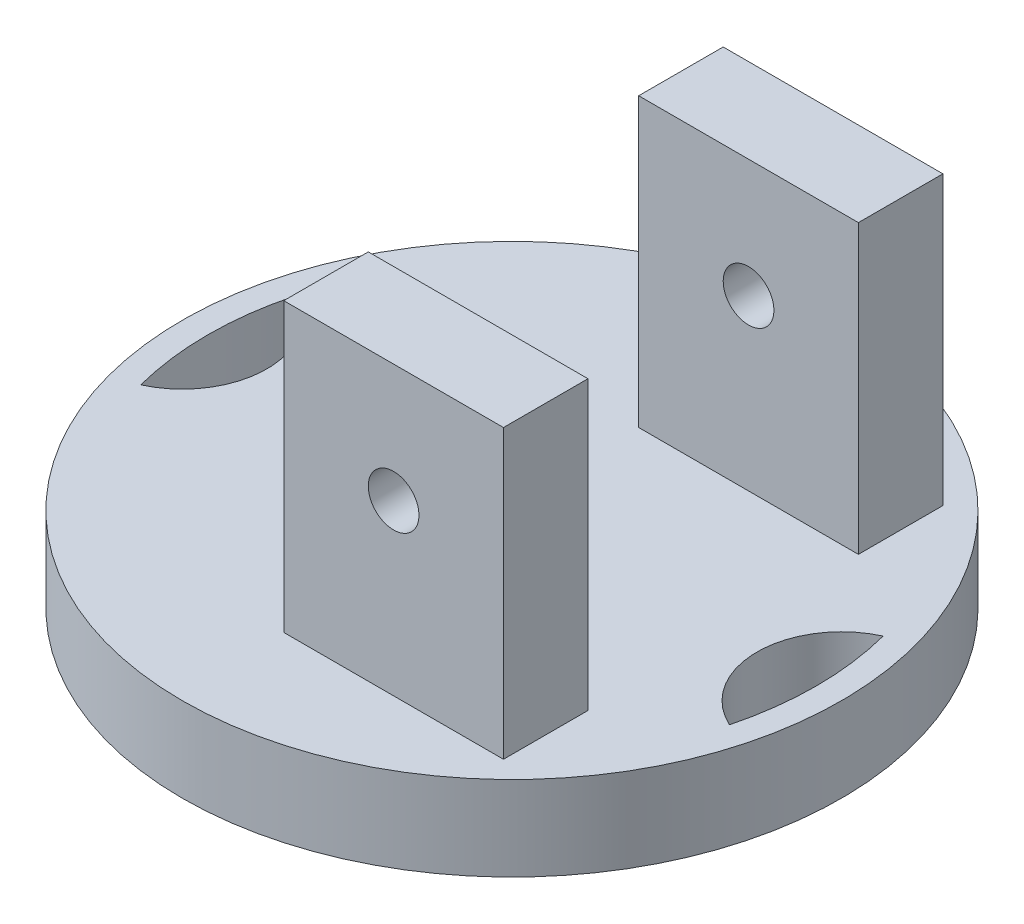
from build123d import *

# Parameters (mm, degrees)
SKETCH1_R           = 24.765
PLATE_DEPTH         = 6.35
SKETCH2_W           = 16.51
SKETCH2_H           = 6.35
HOOK_UPRIGHTS_DEPTH = 21.59
SKETCH3_R           = 1.905
HOOK_BOLTHOLE_DEPTH = 56.655857284


with BuildPart() as part:
    # Sketch1 → plate (new body)
    with BuildSketch(Plane(origin=(0, 0, 0), x_dir=(1, 0, 0), z_dir=(0, 1, 0))):
        Circle(SKETCH1_R)
        with BuildLine():
            ThreePointArc((-22.119166667, -5.772526827), (-22.86, 0), (-22.119166667, 5.772526827))
            ThreePointArc((-22.119166667, 5.772526827), (-18.415, 0), (-22.119166667, -5.772526827))
        make_face(mode=Mode.SUBTRACT)
        with BuildLine():
            ThreePointArc((22.119166667, -5.772526827), (18.415, 0), (22.119166667, 5.772526827))
            ThreePointArc((22.119166667, 5.772526827), (22.86, 0), (22.119166667, -5.772526827))
        make_face(mode=Mode.SUBTRACT)
    extrude(amount=PLATE_DEPTH)

    # Sketch2 → hook_uprights (add)
    with BuildSketch(Plane(origin=(0, 6.35, 0), x_dir=(1, 0, 0), z_dir=(0, 1, 0))):
        with Locations((7.62, 13.335)):
            Rectangle(SKETCH2_W, SKETCH2_H)
        with Locations((7.62, -13.335)):
            Rectangle(SKETCH2_W, SKETCH2_H)
    extrude(amount=HOOK_UPRIGHTS_DEPTH)

    # Sketch3 → hook_bolthole (cut, through all)
    with BuildSketch(Plane(origin=(0, 0, -16.51), x_dir=(-1, 0, 0), z_dir=(0, 0, -1))):
        with Locations((-7.62, 19.05)):
            Circle(SKETCH3_R)
    extrude(amount=-HOOK_BOLTHOLE_DEPTH, mode=Mode.SUBTRACT)


solid = part.part
